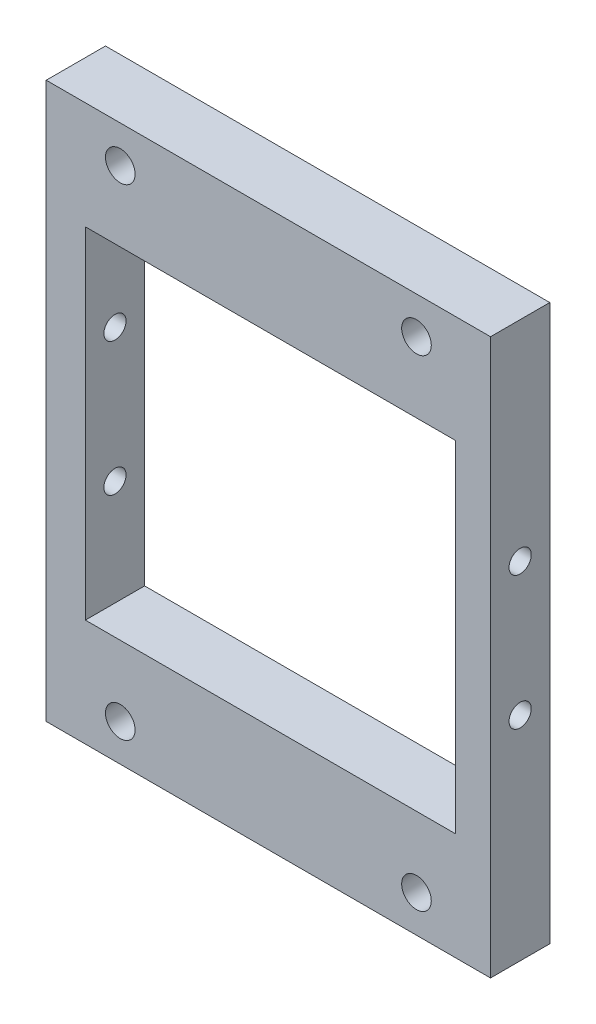
from build123d import *

# Parameters (mm, degrees)
SKETCH_1_W          = 60
SKETCH_1_H          = 75
EXTRUDE_1_DEPTH     = 8
CUT_EXTRUDE_1_REACH = 95.51
SKETCH_3_R          = 2
CUT_EXTRUDE_2_DEPTH = 6
SKETCH_4_R          = 1.5
CUT_EXTRUDE_3_DEPTH = 72.205687975


with BuildPart() as part:
    # 草图1 → 凸台-拉伸1 (new body)
    with BuildSketch(Plane.XY):
        with Locations((-55.287083442, 0)):
            Rectangle(SKETCH_1_W, SKETCH_1_H)
    extrude(amount=EXTRUDE_1_DEPTH)

    # 草图2 → 切除-拉伸1 (cut, up to next)
    with BuildSketch(Plane.XY.offset(8), mode=Mode.PRIVATE) as cut_extrude_1_sk1:
        Polygon((-80, 17), (-80, 23), (-30, 23), (-30, 17), (-30, -17), (-30, -23), (-80, -23), (-80, -17), align=None)
    cut_extrude_1_tool1 = extrude(cut_extrude_1_sk1.sketch, amount=-CUT_EXTRUDE_1_REACH, mode=Mode.PRIVATE) & part.part
    add(cut_extrude_1_tool1.solids().sort_by_distance((-55, 0, 8))[0], mode=Mode.SUBTRACT)

    # 草图3 → 切除-拉伸2 (cut)
    with BuildSketch(Plane.XY.offset(8)):
        with Locations((-75.287083442, -32.5)):
            Circle(SKETCH_3_R)
        with Locations((-35.287083442, -32.5)):
            Circle(SKETCH_3_R)
    cut_extrude_2 = extrude(amount=-CUT_EXTRUDE_2_DEPTH, mode=Mode.SUBTRACT)

    # 镜向1: 切除-拉伸2 across plane
    add(cut_extrude_2.mirror(Plane.ZX), mode=Mode.SUBTRACT)

    # 草图4 → 切除-拉伸3 (cut, through all)
    with BuildSketch(Plane.ZY.offset(85.287083442)):
        with Locations((4, -8.747446088)):
            Circle(SKETCH_4_R)
        with Locations((4, 9.252553912)):
            Circle(SKETCH_4_R)
    extrude(amount=-CUT_EXTRUDE_3_DEPTH, mode=Mode.SUBTRACT)


solid = part.part
